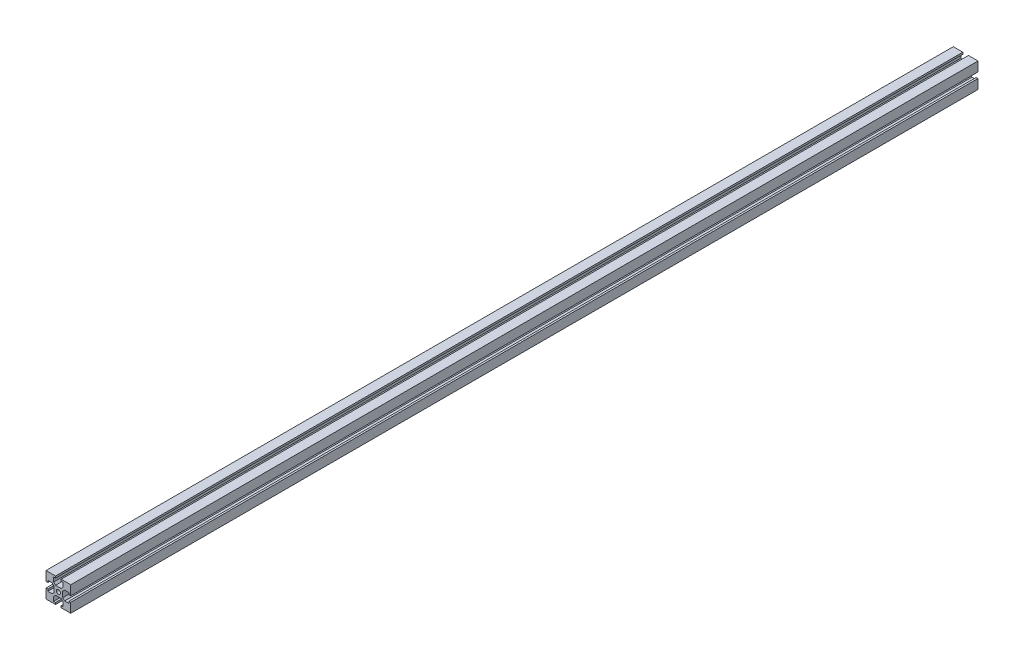
from build123d import *

# Parameters (mm, degrees)
SKETCH_2_R      = 1.25
EXTRUDE_1_DEPTH = 550


with BuildPart() as part:
    # ｽｹｯﾁ2 → ﾎﾞｽ - 押し出し1 (new body)
    with BuildSketch(Plane.XY):
        Polygon((1.7, 2.65), (-1.7, 2.65), (-2.85, 3.8), (-2.85, 6.4), (-1.7, 6.4), (-1.7, 7.5), (-7.5, 7.5), (-7.5, 1.7), (-6.4, 1.7), (-6.4, 2.85), (-3.8, 2.85), (-2.65, 1.7), (-2.65, -1.7), (-3.8, -2.85), (-6.4, -2.85), (-6.4, -1.7), (-7.5, -1.7), (-7.5, -7.5), (-1.7, -7.5), (-1.7, -6.4), (-2.85, -6.4), (-2.85, -3.8), (-1.7, -2.65), (1.7, -2.65), (2.85, -3.8), (2.85, -6.4), (1.7, -6.4), (1.7, -7.5), (7.5, -7.5), (7.5, -1.7), (6.4, -1.7), (6.4, -2.85), (3.8, -2.85), (2.65, -1.7), (2.65, 1.7), (3.8, 2.85), (6.4, 2.85), (6.4, 1.7), (7.5, 1.7), (7.5, 7.5), (1.7, 7.5), (1.7, 6.4), (2.85, 6.4), (2.85, 3.8), align=None)
        Circle(SKETCH_2_R, mode=Mode.SUBTRACT)
    extrude(amount=EXTRUDE_1_DEPTH)


solid = part.part
